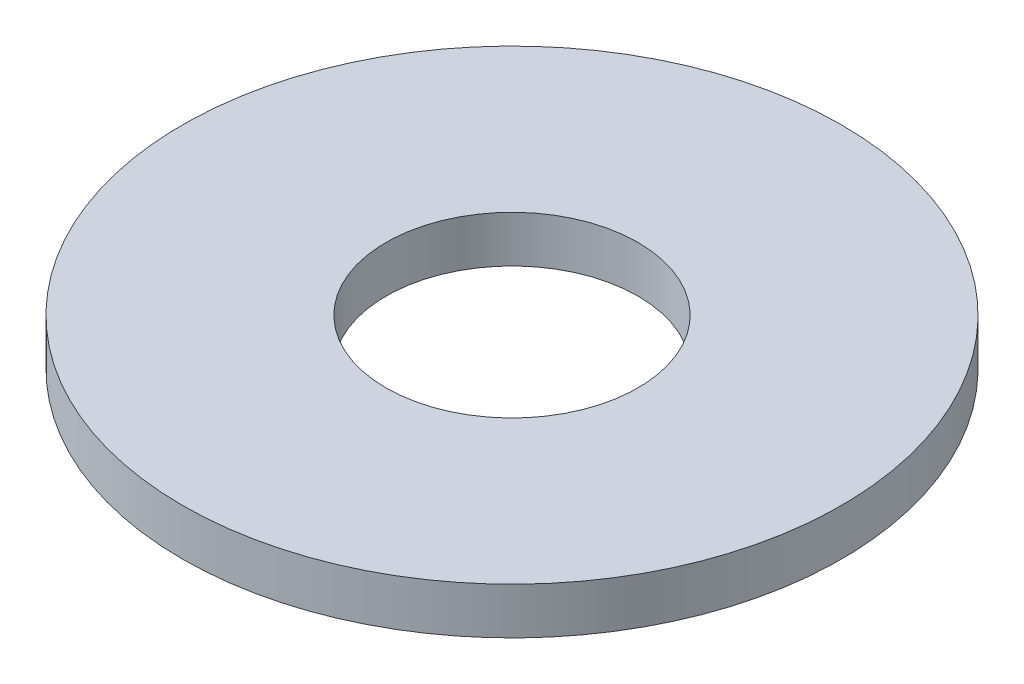
from build123d import *

# Parameters (mm, degrees)
SKETCH1_R           = 85
BOSS_EXTRUDE1_DEPTH = 12
SKETCH2_R           = 32.5
CUT_EXTRUDE1_DEPTH  = 121.805629008


with BuildPart() as part:
    # Sketch1 → Boss-Extrude1 (new body)
    with BuildSketch(Plane(origin=(0, 0, 0), x_dir=(1, 0, 0), z_dir=(0, 1, 0))):
        Circle(SKETCH1_R)
    extrude(amount=BOSS_EXTRUDE1_DEPTH)

    # Sketch2 → Cut-Extrude1 (cut, through all)
    with BuildSketch(Plane(origin=(0, 0, 0), x_dir=(1, 0, 0), z_dir=(0, 1, 0))):
        Circle(SKETCH2_R)
    extrude(amount=CUT_EXTRUDE1_DEPTH, mode=Mode.SUBTRACT)


solid = part.part
